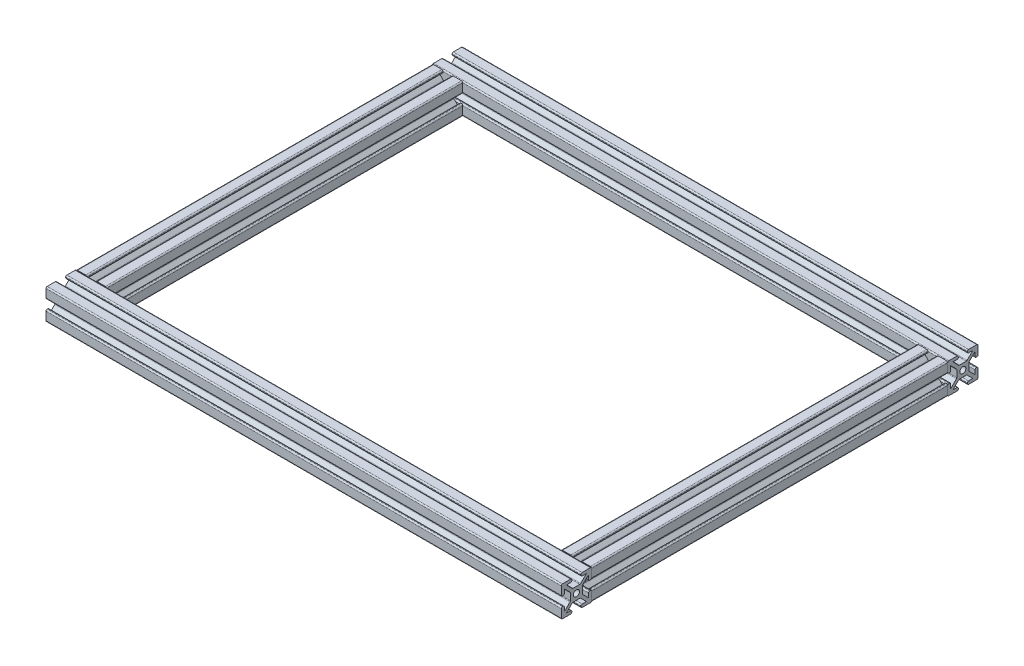
from build123d import *

# Parameters (mm, degrees)
SIZE_START             = -245
SIZE_4X4_1_OUTLINE_R   = 2
SIZE_4X4_1_DEPTH       = 235
SIZE_START_2           = -10
SIZE_4X4_1_2_OUTLINE_R = 2
SIZE_4X4_1_2_DEPTH     = 340
SKETCH12_R             = 2.5
CUT_EXTRUDE1_DEPTH     = 424.703906048


# Read off the part's stored shape, not the designer's step: Size 4X4 (1)
with BuildPart() as part:
    # Size 4X4 (1) outline → Size 4X4 (1) (new body)
    # profile 1 of 2: a face of its own
    with BuildSketch(Plane.XY.offset(SIZE_START)):
        with BuildLine():
            Line((2.254415588, 4), (-2.254415588, 4))
            ThreePointArc((-2.254415588, 4), (-2.560562334, 4.060896374), (-2.820101013, 4.234314575))
            Line((-2.820101013, 4.234314575), (-6.585786438, 8))
            Line((-6.585786438, 8), (-3.8, 8))
            ThreePointArc((-3.8, 8), (-3.234314575, 8.234314575), (-3, 8.8))
            Line((-3, 8.8), (-3, 9.2))
            ThreePointArc((-3, 9.2), (-3.234314575, 9.765685425), (-3.8, 10))
            Line((-3.8, 10), (-9.2, 10))
            ThreePointArc((-9.2, 10), (-9.765685425, 9.765685425), (-10, 9.2))
            Line((-10, 9.2), (-10, 3.8))
            ThreePointArc((-10, 3.8), (-9.765685425, 3.234314575), (-9.2, 3))
            Line((-9.2, 3), (-8.8, 3))
            ThreePointArc((-8.8, 3), (-8.234314575, 3.234314575), (-8, 3.8))
            Line((-8, 3.8), (-8, 6.585786438))
            Line((-8, 6.585786438), (-4.234314575, 2.820101013))
            ThreePointArc((-4.234314575, 2.820101013), (-4.060896374, 2.560562334), (-4, 2.254415588))
            Line((-4, 2.254415588), (-4, -2.254415588))
            ThreePointArc((-4, -2.254415588), (-4.060896374, -2.560562334), (-4.234314575, -2.820101013))
            Line((-4.234314575, -2.820101013), (-8, -6.585786438))
            Line((-8, -6.585786438), (-8, -3.8))
            ThreePointArc((-8, -3.8), (-8.234314575, -3.234314575), (-8.8, -3))
            Line((-8.8, -3), (-9.2, -3))
            ThreePointArc((-9.2, -3), (-9.765685425, -3.234314575), (-10, -3.8))
            Line((-10, -3.8), (-10, -9.2))
            ThreePointArc((-10, -9.2), (-9.765685425, -9.765685425), (-9.2, -10))
            Line((-9.2, -10), (-3.8, -10))
            ThreePointArc((-3.8, -10), (-3.234314575, -9.765685425), (-3, -9.2))
            Line((-3, -9.2), (-3, -8.8))
            ThreePointArc((-3, -8.8), (-3.234314575, -8.234314575), (-3.8, -8))
            Line((-3.8, -8), (-6.585786438, -8))
            Line((-6.585786438, -8), (-2.820101013, -4.234314575))
            ThreePointArc((-2.820101013, -4.234314575), (-2.560562334, -4.060896374), (-2.254415588, -4))
            Line((-2.254415588, -4), (2.254415588, -4))
            ThreePointArc((2.254415588, -4), (2.560562334, -4.060896374), (2.820101013, -4.234314575))
            Line((2.820101013, -4.234314575), (6.585786438, -8))
            Line((6.585786438, -8), (3.8, -8))
            ThreePointArc((3.8, -8), (3.234314575, -8.234314575), (3, -8.8))
            Line((3, -8.8), (3, -9.2))
            ThreePointArc((3, -9.2), (3.234314575, -9.765685425), (3.8, -10))
            Line((3.8, -10), (9.2, -10))
            ThreePointArc((9.2, -10), (9.765685425, -9.765685425), (10, -9.2))
            Line((10, -9.2), (10, -3.8))
            ThreePointArc((10, -3.8), (9.765685425, -3.234314575), (9.2, -3))
            Line((9.2, -3), (8.8, -3))
            ThreePointArc((8.8, -3), (8.234314575, -3.234314575), (8, -3.8))
            Line((8, -3.8), (8, -6.585786438))
            Line((8, -6.585786438), (4.234314575, -2.820101013))
            ThreePointArc((4.234314575, -2.820101013), (4.060896374, -2.560562334), (4, -2.254415588))
            Line((4, -2.254415588), (4, 2.254415588))
            ThreePointArc((4, 2.254415588), (4.060896374, 2.560562334), (4.234314575, 2.820101013))
            Line((4.234314575, 2.820101013), (8, 6.585786438))
            Line((8, 6.585786438), (8, 3.8))
            ThreePointArc((8, 3.8), (8.234314575, 3.234314575), (8.8, 3))
            Line((8.8, 3), (9.2, 3))
            ThreePointArc((9.2, 3), (9.765685425, 3.234314575), (10, 3.8))
            Line((10, 3.8), (10, 9.2))
            ThreePointArc((10, 9.2), (9.765685425, 9.765685425), (9.2, 10))
            Line((9.2, 10), (3.8, 10))
            ThreePointArc((3.8, 10), (3.234314575, 9.765685425), (3, 9.2))
            Line((3, 9.2), (3, 8.8))
            ThreePointArc((3, 8.8), (3.234314575, 8.234314575), (3.8, 8))
            Line((3.8, 8), (6.585786438, 8))
            Line((6.585786438, 8), (2.820101013, 4.234314575))
            ThreePointArc((2.820101013, 4.234314575), (2.560562334, 4.060896374), (2.254415588, 4))
        make_face()
        Circle(SIZE_4X4_1_OUTLINE_R, mode=Mode.SUBTRACT)
    # profile 2 of 2: a face of its own
    with BuildSketch(Plane.XY.offset(SIZE_START)):
        with BuildLine():
            ThreePointArc((322.820101013, 4.234314575), (322.560562334, 4.060896374), (322.254415588, 4))
            Line((322.254415588, 4), (317.745584412, 4))
            ThreePointArc((317.745584412, 4), (317.439437666, 4.060896374), (317.179898987, 4.234314575))
            Line((317.179898987, 4.234314575), (313.414213562, 8))
            Line((313.414213562, 8), (316.2, 8))
            ThreePointArc((316.2, 8), (316.765685425, 8.234314575), (317, 8.8))
            Line((317, 8.8), (317, 9.2))
            ThreePointArc((317, 9.2), (316.765685425, 9.765685425), (316.2, 10))
            Line((316.2, 10), (310.8, 10))
            ThreePointArc((310.8, 10), (310.234314575, 9.765685425), (310, 9.2))
            Line((310, 9.2), (310, 3.8))
            ThreePointArc((310, 3.8), (310.234314575, 3.234314575), (310.8, 3))
            Line((310.8, 3), (311.2, 3))
            ThreePointArc((311.2, 3), (311.765685425, 3.234314575), (312, 3.8))
            Line((312, 3.8), (312, 6.585786438))
            Line((312, 6.585786438), (315.765685425, 2.820101013))
            ThreePointArc((315.765685425, 2.820101013), (315.939103626, 2.560562334), (316, 2.254415588))
            Line((316, 2.254415588), (316, -2.254415588))
            ThreePointArc((316, -2.254415588), (315.939103626, -2.560562334), (315.765685425, -2.820101013))
            Line((315.765685425, -2.820101013), (312, -6.585786438))
            Line((312, -6.585786438), (312, -3.8))
            ThreePointArc((312, -3.8), (311.765685425, -3.234314575), (311.2, -3))
            Line((311.2, -3), (310.8, -3))
            ThreePointArc((310.8, -3), (310.234314575, -3.234314575), (310, -3.8))
            Line((310, -3.8), (310, -9.2))
            ThreePointArc((310, -9.2), (310.234314575, -9.765685425), (310.8, -10))
            Line((310.8, -10), (316.2, -10))
            ThreePointArc((316.2, -10), (316.765685425, -9.765685425), (317, -9.2))
            Line((317, -9.2), (317, -8.8))
            ThreePointArc((317, -8.8), (316.765685425, -8.234314575), (316.2, -8))
            Line((316.2, -8), (313.414213562, -8))
            Line((313.414213562, -8), (317.179898987, -4.234314575))
            ThreePointArc((317.179898987, -4.234314575), (317.439437666, -4.060896374), (317.745584412, -4))
            Line((317.745584412, -4), (322.254415588, -4))
            ThreePointArc((322.254415588, -4), (322.560562334, -4.060896374), (322.820101013, -4.234314575))
            Line((322.820101013, -4.234314575), (326.585786438, -8))
            Line((326.585786438, -8), (323.8, -8))
            ThreePointArc((323.8, -8), (323.234314575, -8.234314575), (323, -8.8))
            Line((323, -8.8), (323, -9.2))
            ThreePointArc((323, -9.2), (323.234314575, -9.765685425), (323.8, -10))
            Line((323.8, -10), (329.2, -10))
            ThreePointArc((329.2, -10), (329.765685425, -9.765685425), (330, -9.2))
            Line((330, -9.2), (330, -3.8))
            ThreePointArc((330, -3.8), (329.765685425, -3.234314575), (329.2, -3))
            Line((329.2, -3), (328.8, -3))
            ThreePointArc((328.8, -3), (328.234314575, -3.234314575), (328, -3.8))
            Line((328, -3.8), (328, -6.585786438))
            Line((328, -6.585786438), (324.234314575, -2.820101013))
            ThreePointArc((324.234314575, -2.820101013), (324.060896374, -2.560562334), (324, -2.254415588))
            Line((324, -2.254415588), (324, 2.254415588))
            ThreePointArc((324, 2.254415588), (324.060896374, 2.560562334), (324.234314575, 2.820101013))
            Line((324.234314575, 2.820101013), (328, 6.585786438))
            Line((328, 6.585786438), (328, 3.8))
            ThreePointArc((328, 3.8), (328.234314575, 3.234314575), (328.8, 3))
            Line((328.8, 3), (329.2, 3))
            ThreePointArc((329.2, 3), (329.765685425, 3.234314575), (330, 3.8))
            Line((330, 3.8), (330, 9.2))
            ThreePointArc((330, 9.2), (329.765685425, 9.765685425), (329.2, 10))
            Line((329.2, 10), (323.8, 10))
            ThreePointArc((323.8, 10), (323.234314575, 9.765685425), (323, 9.2))
            Line((323, 9.2), (323, 8.8))
            ThreePointArc((323, 8.8), (323.234314575, 8.234314575), (323.8, 8))
            Line((323.8, 8), (326.585786438, 8))
            Line((326.585786438, 8), (322.820101013, 4.234314575))
        make_face()
        with Locations((320, 0)):
            Circle(SIZE_4X4_1_OUTLINE_R, mode=Mode.SUBTRACT)
    extrude(amount=SIZE_4X4_1_DEPTH)


with BuildPart() as body_2:
    # Size 4X4 _1 2 outline → Size 4X4 _1 2 (new body)
    # profile 1 of 2: a face of its own
    with BuildSketch(Plane.YZ.offset(SIZE_START_2)):
        with BuildLine():
            ThreePointArc((4.234314575, -257.820101013), (4.060896374, -257.560562334), (4, -257.254415588))
            Line((4, -257.254415588), (4, -252.745584412))
            ThreePointArc((4, -252.745584412), (4.060896374, -252.439437666), (4.234314575, -252.179898987))
            Line((4.234314575, -252.179898987), (8, -248.414213562))
            Line((8, -248.414213562), (8, -251.2))
            ThreePointArc((8, -251.2), (8.234314575, -251.765685425), (8.8, -252))
            Line((8.8, -252), (9.2, -252))
            ThreePointArc((9.2, -252), (9.765685425, -251.765685425), (10, -251.2))
            Line((10, -251.2), (10, -245.8))
            ThreePointArc((10, -245.8), (9.765685425, -245.234314575), (9.2, -245))
            Line((9.2, -245), (3.8, -245))
            ThreePointArc((3.8, -245), (3.234314575, -245.234314575), (3, -245.8))
            Line((3, -245.8), (3, -246.2))
            ThreePointArc((3, -246.2), (3.234314575, -246.765685425), (3.8, -247))
            Line((3.8, -247), (6.585786438, -247))
            Line((6.585786438, -247), (2.820101013, -250.765685425))
            ThreePointArc((2.820101013, -250.765685425), (2.560562334, -250.939103626), (2.254415588, -251))
            Line((2.254415588, -251), (-2.254415588, -251))
            ThreePointArc((-2.254415588, -251), (-2.560562334, -250.939103626), (-2.820101013, -250.765685425))
            Line((-2.820101013, -250.765685425), (-6.585786438, -247))
            Line((-6.585786438, -247), (-3.8, -247))
            ThreePointArc((-3.8, -247), (-3.234314575, -246.765685425), (-3, -246.2))
            Line((-3, -246.2), (-3, -245.8))
            ThreePointArc((-3, -245.8), (-3.234314575, -245.234314575), (-3.8, -245))
            Line((-3.8, -245), (-9.2, -245))
            ThreePointArc((-9.2, -245), (-9.765685425, -245.234314575), (-10, -245.8))
            Line((-10, -245.8), (-10, -251.2))
            ThreePointArc((-10, -251.2), (-9.765685425, -251.765685425), (-9.2, -252))
            Line((-9.2, -252), (-8.8, -252))
            ThreePointArc((-8.8, -252), (-8.234314575, -251.765685425), (-8, -251.2))
            Line((-8, -251.2), (-8, -248.414213562))
            Line((-8, -248.414213562), (-4.234314575, -252.179898987))
            ThreePointArc((-4.234314575, -252.179898987), (-4.060896374, -252.439437666), (-4, -252.745584412))
            Line((-4, -252.745584412), (-4, -257.254415588))
            ThreePointArc((-4, -257.254415588), (-4.060896374, -257.560562334), (-4.234314575, -257.820101013))
            Line((-4.234314575, -257.820101013), (-8, -261.585786438))
            Line((-8, -261.585786438), (-8, -258.8))
            ThreePointArc((-8, -258.8), (-8.234314575, -258.234314575), (-8.8, -258))
            Line((-8.8, -258), (-9.2, -258))
            ThreePointArc((-9.2, -258), (-9.765685425, -258.234314575), (-10, -258.8))
            Line((-10, -258.8), (-10, -264.2))
            ThreePointArc((-10, -264.2), (-9.765685425, -264.765685425), (-9.2, -265))
            Line((-9.2, -265), (-3.8, -265))
            ThreePointArc((-3.8, -265), (-3.234314575, -264.765685425), (-3, -264.2))
            Line((-3, -264.2), (-3, -263.8))
            ThreePointArc((-3, -263.8), (-3.234314575, -263.234314575), (-3.8, -263))
            Line((-3.8, -263), (-6.585786438, -263))
            Line((-6.585786438, -263), (-2.820101013, -259.234314575))
            ThreePointArc((-2.820101013, -259.234314575), (-2.560562334, -259.060896374), (-2.254415588, -259))
            Line((-2.254415588, -259), (2.254415588, -259))
            ThreePointArc((2.254415588, -259), (2.560562334, -259.060896374), (2.820101013, -259.234314575))
            Line((2.820101013, -259.234314575), (6.585786438, -263))
            Line((6.585786438, -263), (3.8, -263))
            ThreePointArc((3.8, -263), (3.234314575, -263.234314575), (3, -263.8))
            Line((3, -263.8), (3, -264.2))
            ThreePointArc((3, -264.2), (3.234314575, -264.765685425), (3.8, -265))
            Line((3.8, -265), (9.2, -265))
            ThreePointArc((9.2, -265), (9.765685425, -264.765685425), (10, -264.2))
            Line((10, -264.2), (10, -258.8))
            ThreePointArc((10, -258.8), (9.765685425, -258.234314575), (9.2, -258))
            Line((9.2, -258), (8.8, -258))
            ThreePointArc((8.8, -258), (8.234314575, -258.234314575), (8, -258.8))
            Line((8, -258.8), (8, -261.585786438))
            Line((8, -261.585786438), (4.234314575, -257.820101013))
        make_face()
        with Locations((0, -255)):
            Circle(SIZE_4X4_1_2_OUTLINE_R, mode=Mode.SUBTRACT)
    # profile 2 of 2: a face of its own
    with BuildSketch(Plane.YZ.offset(SIZE_START_2)):
        with BuildLine():
            Line((4, -2.254415588), (4, 2.254415588))
            ThreePointArc((4, 2.254415588), (4.060896374, 2.560562334), (4.234314575, 2.820101013))
            Line((4.234314575, 2.820101013), (8, 6.585786438))
            Line((8, 6.585786438), (8, 3.8))
            ThreePointArc((8, 3.8), (8.234314575, 3.234314575), (8.8, 3))
            Line((8.8, 3), (9.2, 3))
            ThreePointArc((9.2, 3), (9.765685425, 3.234314575), (10, 3.8))
            Line((10, 3.8), (10, 9.2))
            ThreePointArc((10, 9.2), (9.765685425, 9.765685425), (9.2, 10))
            Line((9.2, 10), (3.8, 10))
            ThreePointArc((3.8, 10), (3.234314575, 9.765685425), (3, 9.2))
            Line((3, 9.2), (3, 8.8))
            ThreePointArc((3, 8.8), (3.234314575, 8.234314575), (3.8, 8))
            Line((3.8, 8), (6.585786438, 8))
            Line((6.585786438, 8), (2.820101013, 4.234314575))
            ThreePointArc((2.820101013, 4.234314575), (2.560562334, 4.060896374), (2.254415588, 4))
            Line((2.254415588, 4), (-2.254415588, 4))
            ThreePointArc((-2.254415588, 4), (-2.560562334, 4.060896374), (-2.820101013, 4.234314575))
            Line((-2.820101013, 4.234314575), (-6.585786438, 8))
            Line((-6.585786438, 8), (-3.8, 8))
            ThreePointArc((-3.8, 8), (-3.234314575, 8.234314575), (-3, 8.8))
            Line((-3, 8.8), (-3, 9.2))
            ThreePointArc((-3, 9.2), (-3.234314575, 9.765685425), (-3.8, 10))
            Line((-3.8, 10), (-9.2, 10))
            ThreePointArc((-9.2, 10), (-9.765685425, 9.765685425), (-10, 9.2))
            Line((-10, 9.2), (-10, 3.8))
            ThreePointArc((-10, 3.8), (-9.765685425, 3.234314575), (-9.2, 3))
            Line((-9.2, 3), (-8.8, 3))
            ThreePointArc((-8.8, 3), (-8.234314575, 3.234314575), (-8, 3.8))
            Line((-8, 3.8), (-8, 6.585786438))
            Line((-8, 6.585786438), (-4.234314575, 2.820101013))
            ThreePointArc((-4.234314575, 2.820101013), (-4.060896374, 2.560562334), (-4, 2.254415588))
            Line((-4, 2.254415588), (-4, -2.254415588))
            ThreePointArc((-4, -2.254415588), (-4.060896374, -2.560562334), (-4.234314575, -2.820101013))
            Line((-4.234314575, -2.820101013), (-8, -6.585786438))
            Line((-8, -6.585786438), (-8, -3.8))
            ThreePointArc((-8, -3.8), (-8.234314575, -3.234314575), (-8.8, -3))
            Line((-8.8, -3), (-9.2, -3))
            ThreePointArc((-9.2, -3), (-9.765685425, -3.234314575), (-10, -3.8))
            Line((-10, -3.8), (-10, -9.2))
            ThreePointArc((-10, -9.2), (-9.765685425, -9.765685425), (-9.2, -10))
            Line((-9.2, -10), (-3.8, -10))
            ThreePointArc((-3.8, -10), (-3.234314575, -9.765685425), (-3, -9.2))
            Line((-3, -9.2), (-3, -8.8))
            ThreePointArc((-3, -8.8), (-3.234314575, -8.234314575), (-3.8, -8))
            Line((-3.8, -8), (-6.585786438, -8))
            Line((-6.585786438, -8), (-2.820101013, -4.234314575))
            ThreePointArc((-2.820101013, -4.234314575), (-2.560562334, -4.060896374), (-2.254415588, -4))
            Line((-2.254415588, -4), (2.254415588, -4))
            ThreePointArc((2.254415588, -4), (2.560562334, -4.060896374), (2.820101013, -4.234314575))
            Line((2.820101013, -4.234314575), (6.585786438, -8))
            Line((6.585786438, -8), (3.8, -8))
            ThreePointArc((3.8, -8), (3.234314575, -8.234314575), (3, -8.8))
            Line((3, -8.8), (3, -9.2))
            ThreePointArc((3, -9.2), (3.234314575, -9.765685425), (3.8, -10))
            Line((3.8, -10), (9.2, -10))
            ThreePointArc((9.2, -10), (9.765685425, -9.765685425), (10, -9.2))
            Line((10, -9.2), (10, -3.8))
            ThreePointArc((10, -3.8), (9.765685425, -3.234314575), (9.2, -3))
            Line((9.2, -3), (8.8, -3))
            ThreePointArc((8.8, -3), (8.234314575, -3.234314575), (8, -3.8))
            Line((8, -3.8), (8, -6.585786438))
            Line((8, -6.585786438), (4.234314575, -2.820101013))
            ThreePointArc((4.234314575, -2.820101013), (4.060896374, -2.560562334), (4, -2.254415588))
        make_face()
        Circle(SIZE_4X4_1_2_OUTLINE_R, mode=Mode.SUBTRACT)
    extrude(amount=SIZE_4X4_1_2_DEPTH)

    # Sketch12 → Cut-Extrude1 (cut, through all)
    with BuildSketch(Plane.XZ.offset(10)):
        with Locations(Location((180, -255, 0), (0, 0, 295.608789006))):
            Circle(SKETCH12_R)
        with Locations(Location((140, -255, 0), (0, 0, 295.608789006))):
            Circle(SKETCH12_R)
    extrude(amount=-CUT_EXTRUDE1_DEPTH, mode=Mode.SUBTRACT)


solid = Compound([part.part, body_2.part])
